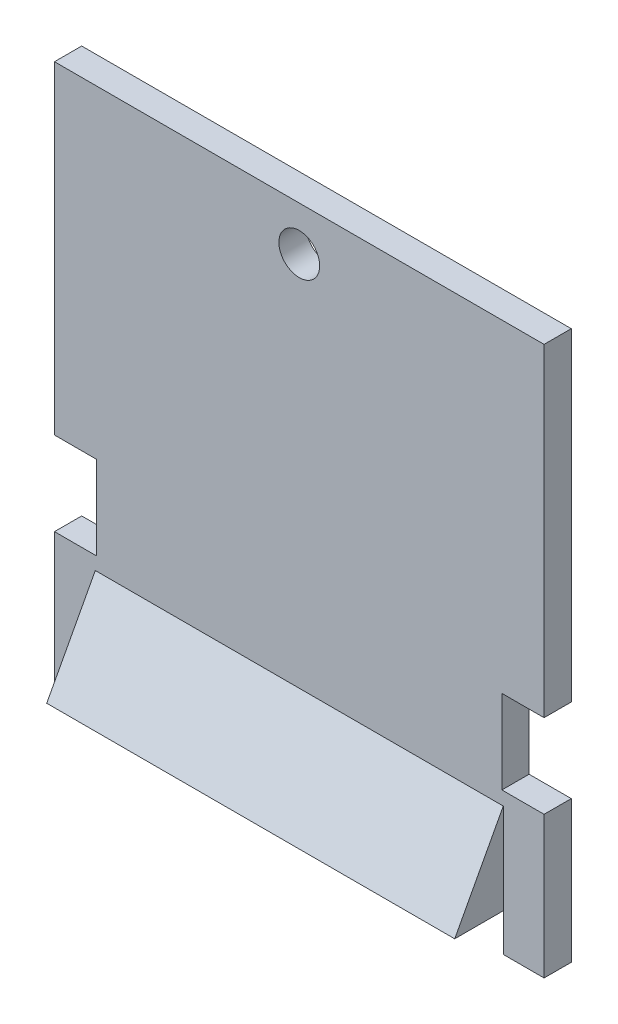
from build123d import *

# Parameters (mm, degrees)
BOSS_EXTRUDE1_DEPTH = 18
SKETCH2_R           = 1.5
SKETCH2_W           = 30
SKETCH2_H           = 2.78
CUT_EXTRUDE1_DEPTH  = 45.532543157
SKETCH3_W           = 3.1
SKETCH3_H           = 6.15
CUT_EXTRUDE2_DEPTH  = 45.532543157
SKETCH4_W           = 3
SKETCH4_H           = 7.645
CUT_EXTRUDE3_DEPTH  = 45.326824836


with BuildPart() as part:
    # Sketch1 → Boss-Extrude1 (new, symmetric)
    with BuildSketch(Plane(origin=(0, 0, 0), x_dir=(0, 0, -1), z_dir=(1, 0, 0))):
        Polygon((0, 0), (0, 40.35), (-2, 40.35), (-2, 9.45), (-5.57, 2.78), (-2, 2.78), (-2, 0), align=None)
    extrude(amount=BOSS_EXTRUDE1_DEPTH, both=True)

    # Sketch2 → Cut-Extrude1 (cut, through all)
    with BuildSketch(Plane(origin=(0, 0, 0), x_dir=(-1, 0, 0), z_dir=(0, 0, -1))):
        with Locations((0, 37.1)):
            Circle(SKETCH2_R)
        with Locations((0, 1.39)):
            Rectangle(SKETCH2_W, SKETCH2_H)
    extrude(amount=-CUT_EXTRUDE1_DEPTH, mode=Mode.SUBTRACT)

    # Sketch3 → Cut-Extrude2 (cut, through all)
    with BuildSketch(Plane(origin=(0, 0, 0), x_dir=(-1, 0, 0), z_dir=(0, 0, -1))):
        with Locations((-16.45, 13.5)):
            Rectangle(SKETCH3_W, SKETCH3_H)
        with Locations((16.45, 13.5)):
            Rectangle(SKETCH3_W, SKETCH3_H)
    extrude(amount=-CUT_EXTRUDE2_DEPTH, mode=Mode.SUBTRACT)

    # Sketch4 → Cut-Extrude3 (cut, through all)
    with BuildSketch(Plane.XY.offset(2)):
        with Locations((-16.5, 6.6025)):
            Rectangle(SKETCH4_W, SKETCH4_H)
        with Locations((16.5, 6.6025)):
            Rectangle(SKETCH4_W, SKETCH4_H)
    extrude(amount=CUT_EXTRUDE3_DEPTH, mode=Mode.SUBTRACT)


solid = part.part
